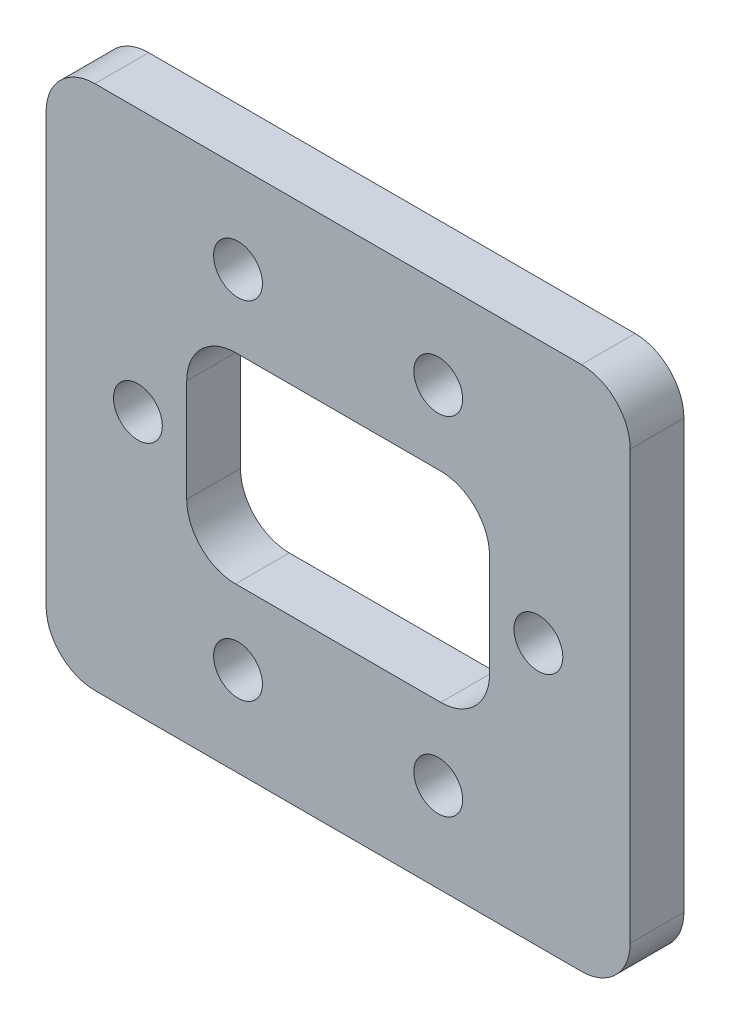
from build123d import *

# Parameters (mm, degrees)
SKETCH_1_R          = 2.5
EXTRUDE_1_DEPTH     = 5.5
CUT_EXTRUDE_START   = -10
CUT_EXTRUDE_1_DEPTH = 10


with BuildPart() as part:
    # 草圖1 → 填料-伸長1 (new body)
    with BuildSketch(Plane.XY):
        with BuildLine():
            Line((30.92213123, 27.674760766), (-28.87786877, 27.674760766))
            ThreePointArc((-28.87786877, 27.674760766), (-32.413402676, 26.210294671), (-33.87786877, 22.674760766))
            Line((-33.87786877, 22.674760766), (-33.87786877, -21.125239234))
            ThreePointArc((-33.87786877, -21.125239234), (-32.413402676, -24.66077314), (-28.87786877, -26.125239234))
            Line((-28.87786877, -26.125239234), (30.92213123, -26.125239234))
            ThreePointArc((30.92213123, -26.125239234), (34.457665136, -24.66077314), (35.92213123, -21.125239234))
            Line((35.92213123, -21.125239234), (35.92213123, 22.674760766))
            ThreePointArc((35.92213123, 22.674760766), (34.457665136, 26.210294671), (30.92213123, 27.674760766))
        make_face()
        with BuildLine():
            ThreePointArc((16.52213123, -4.478760012), (15.057665136, -8.014293918), (11.52213123, -9.478760012))
            Line((11.52213123, -9.478760012), (-9.47786877, -9.478760012))
            ThreePointArc((-9.47786877, -9.478760012), (-13.013402676, -8.014293918), (-14.47786877, -4.478760012))
            Line((-14.47786877, -4.478760012), (-14.47786877, 6.028281543))
            ThreePointArc((-14.47786877, 6.028281543), (-13.013402676, 9.563815449), (-9.47786877, 11.028281543))
            Line((-9.47786877, 11.028281543), (11.52213123, 11.028281543))
            ThreePointArc((11.52213123, 11.028281543), (15.057665136, 9.563815449), (16.52213123, 6.028281543))
            Line((16.52213123, 6.028281543), (16.52213123, -4.478760012))
        make_face(mode=Mode.SUBTRACT)
        with Locations((11.27213123, -16.978760012)):
            Circle(SKETCH_1_R, mode=Mode.SUBTRACT)
        with Locations((21.52213123, 0.774760766)):
            Circle(SKETCH_1_R, mode=Mode.SUBTRACT)
        with Locations((-9.22786877, 18.528281543)):
            Circle(SKETCH_1_R, mode=Mode.SUBTRACT)
        with Locations((11.27213123, 18.528281543)):
            Circle(SKETCH_1_R, mode=Mode.SUBTRACT)
        with Locations((-9.22786877, -16.978760012)):
            Circle(SKETCH_1_R, mode=Mode.SUBTRACT)
        with Locations((-19.47786877, 0.774760766)):
            Circle(SKETCH_1_R, mode=Mode.SUBTRACT)
    extrude(amount=EXTRUDE_1_DEPTH)

    # 草圖24 → 除料-伸長1 (cut)
    with BuildSketch(Plane.XY.offset(5.5).offset(CUT_EXTRUDE_START)):
        with BuildLine():
            Line((-28.87786877, -21.125239234), (-28.87786877, 22.674760766))
            ThreePointArc((-28.87786877, 22.674760766), (-27.413402676, 26.210294671), (-23.87786877, 27.674760766))
            Line((-23.87786877, 27.674760766), (-28.87786877, 27.674760766))
            ThreePointArc((-28.87786877, 27.674760766), (-32.413402676, 26.210294671), (-33.87786877, 22.674760766))
            Line((-33.87786877, 22.674760766), (-33.87786877, -21.125239234))
            ThreePointArc((-33.87786877, -21.125239234), (-32.413402676, -24.66077314), (-28.87786877, -26.125239234))
            Line((-28.87786877, -26.125239234), (-23.87786877, -26.125239234))
            ThreePointArc((-23.87786877, -26.125239234), (-27.413402676, -24.66077314), (-28.87786877, -21.125239234))
        make_face()
        with BuildLine():
            Line((30.92213123, 27.674760766), (25.92213123, 27.674760766))
            ThreePointArc((25.92213123, 27.674760766), (29.457665136, 26.210294671), (30.92213123, 22.674760766))
            Line((30.92213123, 22.674760766), (30.92213123, -21.125239234))
            ThreePointArc((30.92213123, -21.125239234), (29.457665136, -24.66077314), (25.92213123, -26.125239234))
            Line((25.92213123, -26.125239234), (30.92213123, -26.125239234))
            ThreePointArc((30.92213123, -26.125239234), (34.457665136, -24.66077314), (35.92213123, -21.125239234))
            Line((35.92213123, -21.125239234), (35.92213123, 22.674760766))
            ThreePointArc((35.92213123, 22.674760766), (34.457665136, 26.210294671), (30.92213123, 27.674760766))
        make_face()
    extrude(amount=CUT_EXTRUDE_1_DEPTH, mode=Mode.SUBTRACT)


solid = part.part
